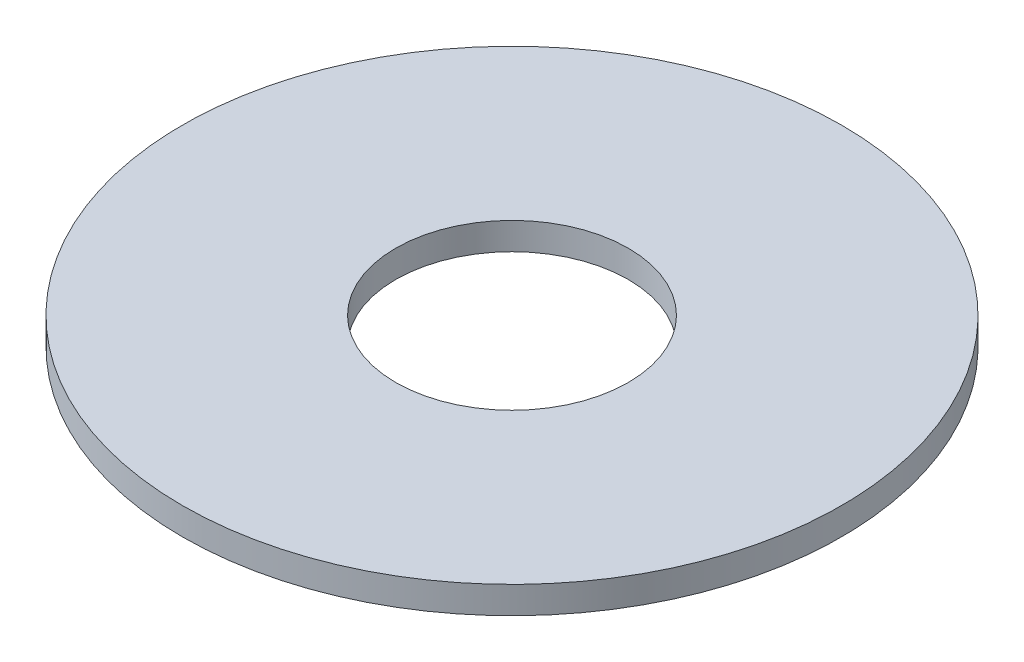
from build123d import *

# Parameters (mm, degrees)
SKETCH1_R           = 85
BOSS_EXTRUDE1_DEPTH = 7
SKETCH2_R           = 30
CUT_EXTRUDE1_DEPTH  = 121.411793442


with BuildPart() as part:
    # Sketch1 → Boss-Extrude1 (new body)
    with BuildSketch(Plane(origin=(0, 0, 0), x_dir=(1, 0, 0), z_dir=(0, 1, 0))):
        Circle(SKETCH1_R)
    extrude(amount=BOSS_EXTRUDE1_DEPTH)

    # Sketch2 → Cut-Extrude1 (cut, through all)
    with BuildSketch(Plane(origin=(0, 0, 0), x_dir=(1, 0, 0), z_dir=(0, 1, 0))):
        Circle(SKETCH2_R)
    extrude(amount=CUT_EXTRUDE1_DEPTH, mode=Mode.SUBTRACT)


solid = part.part
